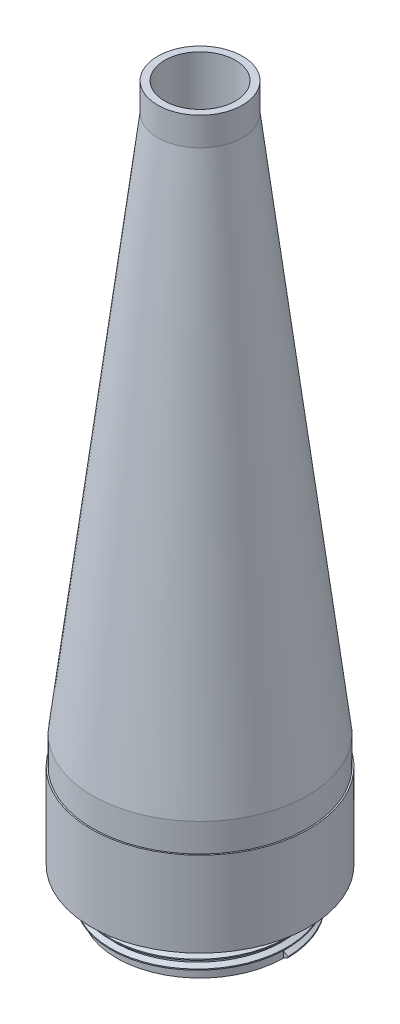
from build123d import *

# Parameters (mm, degrees)
CROQUIS1_R              = 38
SALIENTE_EXTRUIR1_DEPTH = 40
CROQUIS2_R              = 15
CROQUIS3_R              = 20.75
CORTAR_EXTRUIR1_DEPTH   = 113
CROQUIS4_R              = 22
CORTAR_EXTRUIR2_DEPTH   = 2
CROQUIS5_R              = 12.5
CORTAR_EXTRUIR3_DEPTH   = 119
CHAFL_N1_SIZE           = 23.589576126
CHAFL_N1_SIZE_2         = 11
SALIENTE_EXTRUIR2_START = 14
CROQUIS6_R              = 29.5
CROQUIS6_R_2            = 22
SALIENTE_EXTRUIR2_DEPTH = 14
ROSCA1_PITCH            = 3
CROQUIS7_R              = 38.5
CROQUIS7_R_2            = 38
SALIENTE_EXTRUIR3_DEPTH = 30
SALIENTE_EXTRUIR4_START = 10
CROQUIS8_R              = 15
CROQUIS8_R_2            = 12.5
SALIENTE_EXTRUIR4_DEPTH = 10


with BuildPart() as part:
    # Croquis1 → Saliente-Extruir1 (new body)
    with BuildSketch(Plane(origin=(0, 0, 0), x_dir=(1, 0, 0), z_dir=(0, 1, 0))):
        with Locations(Location((0, 0, 0), (0, 0, 270))):
            Circle(CROQUIS1_R)
    extrude(amount=SALIENTE_EXTRUIR1_DEPTH)

    # Croquis2 → section 0 of recubrir1
    with BuildSketch(Plane(origin=(0, 230, 0), x_dir=(1, 0, 0), z_dir=(0, 1, 0)), mode=Mode.PRIVATE) as recubrir1_s0:
        Circle(CROQUIS2_R)
    # loft up to a face of the part (recubrir1)
    loft([recubrir1_s0.sketch, Face(Wire([part.edges().sort_by_distance((27.700807842, 40, -26.012790025))[0]]))])

    # Croquis3 → Cortar-Extruir1 (cut)
    with BuildSketch(Plane.XZ):
        with Locations(Location((0, 0, 0), (0, 0, 270))):
            Circle(CROQUIS3_R)
    extrude(amount=-CORTAR_EXTRUIR1_DEPTH, mode=Mode.SUBTRACT)

    # Croquis4 → Cortar-Extruir2 (cut)
    with BuildSketch(Plane.XZ):
        with Locations(Location((0, 0, 0), (0, 0, 270))):
            Circle(CROQUIS4_R)
    extrude(amount=-CORTAR_EXTRUIR2_DEPTH, mode=Mode.SUBTRACT)

    # Croquis5 → Cortar-Extruir3 (cut)
    with BuildSketch(Plane(origin=(0, 230, 0), x_dir=(1, 0, 0), z_dir=(0, 1, 0))):
        with Locations(Location((0, 0, 0), (0, 0, 270))):
            Circle(CROQUIS5_R)
    extrude(amount=-CORTAR_EXTRUIR3_DEPTH, mode=Mode.SUBTRACT)

    # Chaflán1
    # the kernel refuses this chamfer: 23.589576126, 11 mm, written as the material it takes off along each edge
    with BuildSketch(Plane(origin=(0, 113, 0), x_dir=(0, 0, 1), z_dir=(-1, 0, 0))) as chafl_n1_piece_1_section:
        Polygon((12.5, CHAFL_N1_SIZE), (12.5 + CHAFL_N1_SIZE_2, 0), (12.5, 0), align=None)
    chafl_n1_piece_1 = revolve(axis=Axis((0, 113, 0), (0, 1, 0)), mode=Mode.PRIVATE)
    chafl_n1_piece_1 = chafl_n1_piece_1 & Plane(origin=(0, 128.070474592, 0), x_dir=(0, 0, -1), z_dir=(0, -1, 0)) * Cylinder(20.75, 95, mode=Mode.PRIVATE)
    add(chafl_n1_piece_1, mode=Mode.SUBTRACT)

    # Croquis6 → Saliente-Extruir2 (add)
    with BuildSketch(Plane.XZ.offset(SALIENTE_EXTRUIR2_START)):
        with Locations(Location((0, 0, 0), (0, 0, 270))):
            Circle(CROQUIS6_R)
        with Locations(Location((0, 0, 0), (0, 0, 270))):
            Circle(CROQUIS6_R_2, mode=Mode.SUBTRACT)
    extrude(amount=-SALIENTE_EXTRUIR2_DEPTH)

    # Rosca1: the profile of Perfil de rosca1 profile screwed along a right-hand helix of 4.666667 turns, 10 arcs to a turn; built about Z, then put on its axis
    rosca1_z = Axis((0, 0, 0), (0, 0, 1))
    rosca1_corners = [(29.4997, 0, -0.000173205), (31.123797625, 0, 0.937499996), (31.123797625, 0, 1.312499996), (29.4997, 0, 2.250173197)]
    with BuildLine(mode=Mode.PRIVATE) as rosca1_profile:
        Line(rosca1_corners[0], rosca1_corners[1])
        Line(rosca1_corners[1], rosca1_corners[2])
        Line(rosca1_corners[2], rosca1_corners[3])
        Line(rosca1_corners[3], rosca1_corners[0])
    rosca1_cap = Face(rosca1_profile.wire())
    rosca1_turn_angles = [0, 18, 36, 54, 72, 90, 108, 126, 144, 162, 180, 198, 216, 234, 252, 270, 288, 306, 324, 342, 360]
    rosca1_turn_weights = [1, 0.9510565162951535, 1, 0.9510565162951535, 1, 0.9510565162951535, 1, 0.9510565162951535, 1, 0.9510565162951535, 1, 0.9510565162951535, 1, 0.9510565162951535, 1, 0.9510565162951535, 1, 0.9510565162951535, 1, 0.9510565162951535, 1]
    rosca1_turn_rails = [Edge.make_bspline([Vector(p[0], p[1], 0).rotate(rosca1_z, rosca1_turn_angles[k]) / rosca1_turn_weights[k] + Vector(0, 0, p[2] + ROSCA1_PITCH * rosca1_turn_angles[k] / 360) for k in range(21)], [0, 0, 0, 1, 1, 2, 2, 3, 3, 4, 4, 5, 5, 6, 6, 7, 7, 8, 8, 9, 9, 10, 10, 10], 2, rosca1_turn_weights) for p in rosca1_corners]
    rosca1_turn_sides = [Face.make_surface_from_curves(rosca1_turn_rails[p[0]], rosca1_turn_rails[p[1]]) for p in [(0, 1), (1, 2), (2, 3), (3, 0)]]
    rosca1_last_angles = [1440, 1458, 1476, 1494, 1512, 1530, 1548, 1566, 1584, 1602, 1620, 1638, 1656, 1668, 1680]
    rosca1_last_weights = [1, 0.9510565162951535, 1, 0.9510565162951535, 1, 0.9510565162951535, 1, 0.9510565162951535, 1, 0.9510565162951535, 1, 0.9510565162951535, 1, 0.9781476007338065, 1]
    rosca1_last_rails = [Edge.make_bspline([Vector(p[0], p[1], 0).rotate(rosca1_z, rosca1_last_angles[k]) / rosca1_last_weights[k] + Vector(0, 0, p[2] + ROSCA1_PITCH * rosca1_last_angles[k] / 360) for k in range(15)], [0, 0, 0, 1, 1, 2, 2, 3, 3, 4, 4, 5, 5, 6, 6, 7, 7, 7], 2, rosca1_last_weights) for p in rosca1_corners]
    rosca1_last_sides = [Face.make_surface_from_curves(rosca1_last_rails[p[0]], rosca1_last_rails[p[1]]) for p in [(0, 1), (1, 2), (2, 3), (3, 0)]]
    rosca1 = Plane(origin=(0, -14, 0), x_dir=(1, 0, 0), z_dir=(0, 1, 0)) * Solid(Shell([*[p.moved(Location((0, 0, ROSCA1_PITCH * i))) for i in range(4) for p in rosca1_turn_sides], *rosca1_last_sides, rosca1_cap, rosca1_cap.rotate(rosca1_z, 1680).moved(Location((0, 0, ROSCA1_PITCH * 1680 / 360)))]))
    add(rosca1)

    # Croquis7 → Saliente-Extruir3 (add)
    with BuildSketch(Plane.XZ):
        with Locations(Location((0, 0, 0), (0, 0, 270))):
            Circle(CROQUIS7_R)
        with Locations(Location((0, 0, 0), (0, 0, 270))):
            Circle(CROQUIS7_R_2, mode=Mode.SUBTRACT)
    extrude(amount=-SALIENTE_EXTRUIR3_DEPTH)

    # Croquis8 → Saliente-Extruir4 (add)
    with BuildSketch(Plane(origin=(0, 230, 0), x_dir=(1, 0, 0), z_dir=(0, 1, 0)).offset(SALIENTE_EXTRUIR4_START)):
        with Locations(Location((0, 0, 0), (0, 0, 270))):
            Circle(CROQUIS8_R)
        with Locations(Location((0, 0, 0), (0, 0, 270))):
            Circle(CROQUIS8_R_2, mode=Mode.SUBTRACT)
    extrude(amount=-SALIENTE_EXTRUIR4_DEPTH)


solid = part.part
